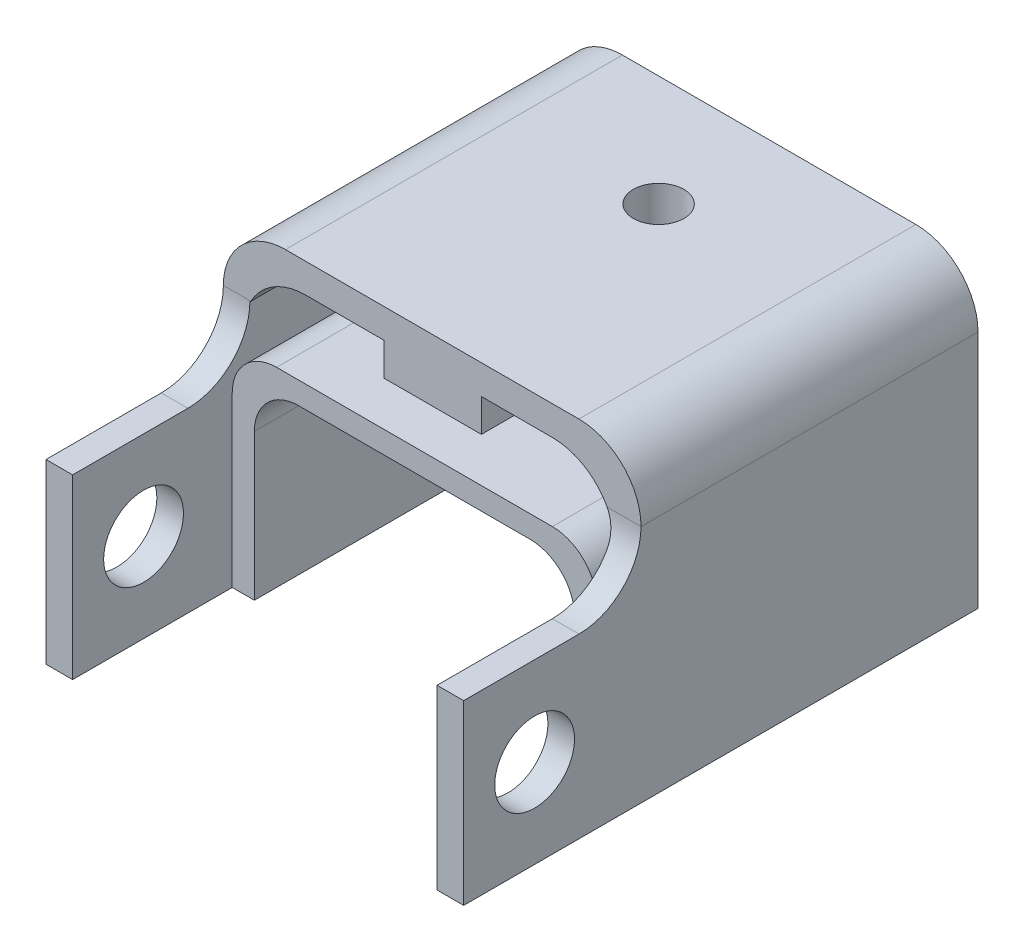
from build123d import *

# Parameters (mm, degrees)
BOSS_EXTRUDE1_DEPTH             = 23.5
BOSS_EXTRUDE1_DEPTH_BACK        = 23.6
SKETCH1_W                       = 38
SKETCH1_H                       = 34
SKETCH2_W                       = 41.1
SKETCH2_H                       = 27
CUT_EXTRUDE1_DEPTH              = 38
FILLET1_R                       = 7
SKETCH3_W                       = 15
SKETCH3_H                       = 3.7
CUT_EXTRUDE2_DEPTH              = 38
FILLET2_R                       = 7
SKETCH4_W                       = 3
SKETCH4_H                       = 20
BOSS_EXTRUDE2_DEPTH             = 20
FILLET3_R                       = 7
CUT_EXTRUDE3_REACH              = 50.651
SKETCH5_R                       = 4.5
CUT_EXTRUDE3_DIRECTION_2_REACH  = 50.651
BOSS_EXTRUDE3_DEPTH             = 40
CUT_EXTRUDE4_DEPTH              = 8
BOSS_EXTRUDE4_DEPTH             = 2.5
BOSS_EXTRUDE5_START             = 2.5
BOSS_EXTRUDE5_DEPTH             = 2.5
BOSS_EXTRUDE6_REACH             = 50.651
SKETCH11_R                      = 8
BOSS_EXTRUDE6_DIRECTION_2_REACH = 50.651
SKETCH12_R                      = 2.85
CUT_EXTRUDE5_DEPTH              = 7


with BuildPart() as part:
    # Sketch1 → Boss-Extrude1 (new, two sides: drawn at the far end of the back side and taken through both)
    with BuildSketch(Plane(origin=(0, 0, 0), x_dir=(0, 0, -1), z_dir=(1, 0, 0)).offset(-BOSS_EXTRUDE1_DEPTH_BACK)):
        Rectangle(SKETCH1_W, SKETCH1_H)
    extrude(amount=BOSS_EXTRUDE1_DEPTH + BOSS_EXTRUDE1_DEPTH_BACK)

    # Sketch2 → Cut-Extrude1 (cut)
    with BuildSketch(Plane.XY.offset(19)):
        with Locations((-0.05, -3.5)):
            Rectangle(SKETCH2_W, SKETCH2_H)
    extrude(amount=-CUT_EXTRUDE1_DEPTH, mode=Mode.SUBTRACT)

    # Fillet1
    fillet1_edges = [part.edges().sort_by_distance(p)[0] for p in [
        (23.5, 17, 0),
        (-23.6, 17, 0),
    ]]
    fillet(fillet1_edges, radius=FILLET1_R)

    # Sketch3 → Cut-Extrude2 (cut)
    with BuildSketch(Plane.XY.offset(19)):
        with Locations((13, 11.85)):
            Rectangle(SKETCH3_W, SKETCH3_H)
        with Locations((-13, 11.85)):
            Rectangle(SKETCH3_W, SKETCH3_H)
    extrude(amount=-CUT_EXTRUDE2_DEPTH, mode=Mode.SUBTRACT)

    # Fillet2
    # the kernel refuses this fillet: 7 mm, written as the material it adds along each edge
    with BuildSketch(Plane(origin=(-20.5, 13.7, 19), x_dir=(1, 0, 0), z_dir=(0, 0, -1))) as fillet2_piece_1:
        with BuildLine():
            CenterArc((6.173329734, 7), FILLET2_R, 208.127068219, 61.872931781)
            Line((0, 3.7), (-0.123466595, 3.634))
            ThreePointArc((-0.123466595, 3.634), (-0.14, 1.85), (-0.14, 0))
            Line((-0.14, 0), (0, -0.14))
            Line((0, -0.14), (6.173329734, -0.14))
            Line((6.173329734, -0.14), (6.173329734, 0))
        make_face()
    extrude(amount=38)
    with BuildSketch(Plane(origin=(20.5, 13.7, 19), x_dir=(0, -1, 0), z_dir=(0, 0, -1))) as fillet2_piece_2:
        with BuildLine():
            CenterArc((FILLET2_R, FILLET2_R), FILLET2_R, 180, 90)
            Line((0, FILLET2_R), (-FILLET2_R * 0.02, FILLET2_R))
            Line((-FILLET2_R * 0.02, FILLET2_R), (-FILLET2_R * 0.02, -FILLET2_R * 0.02))
            Line((-FILLET2_R * 0.02, -FILLET2_R * 0.02), (FILLET2_R, -FILLET2_R * 0.02))
            Line((FILLET2_R, -FILLET2_R * 0.02), (FILLET2_R, 0))
        make_face()
    extrude(amount=38)

    # Sketch4 → Boss-Extrude2 (add)
    with BuildSketch(Plane.XY.offset(19)):
        with Locations((-22.1, -7)):
            Rectangle(SKETCH4_W, SKETCH4_H)
        with Locations((22, -7)):
            Rectangle(SKETCH4_W, SKETCH4_H)
    extrude(amount=BOSS_EXTRUDE2_DEPTH)

    # Fillet3
    fillet3_edges = [part.edges().sort_by_distance(p)[0] for p in [
        (-22.1, 3, 19),
        (22, 3, 19),
    ]]
    fillet(fillet3_edges, radius=FILLET3_R)

    # Cut-Extrude3: up to this face of the body (flat: up to its plane)
    cut_extrude3_end = Plane(part.part.faces().sort_by_distance((-23.6, -4.415554034, 8.225623848))[0])
    # Sketch5 → Cut-Extrude3 (cut, up to the picked face)
    with BuildSketch(Plane(origin=(0, 0, 0), x_dir=(0, 0, -1), z_dir=(1, 0, 0)), mode=Mode.PRIVATE) as cut_extrude3_sk1:
        with Locations((-31, -7)):
            Circle(SKETCH5_R)
    cut_extrude3_tool1 = split(extrude(cut_extrude3_sk1.sketch, amount=-CUT_EXTRUDE3_REACH, mode=Mode.PRIVATE), bisect_by=cut_extrude3_end, keep=Keep.BOTH, mode=Mode.PRIVATE)
    add(cut_extrude3_tool1.solids().sort_by(Axis((0, -7, 31), (-1, 0, 0)))[0], mode=Mode.SUBTRACT)

    # Cut-Extrude3 direction 2: up to this face of the body (flat: up to its plane)
    cut_extrude3_direction_2_end = Plane(part.part.faces().sort_by_distance((23.5, -4.415554034, 8.225623848))[0])
    # Sketch5 → Cut-Extrude3 direction 2 (cut, up to the picked face)
    with BuildSketch(Plane(origin=(0, 0, 0), x_dir=(0, 0, -1), z_dir=(1, 0, 0)), mode=Mode.PRIVATE) as cut_extrude3_direction_2_sk1:
        with Locations((-31, -7)):
            Circle(SKETCH5_R)
    cut_extrude3_direction_2_tool1 = split(extrude(cut_extrude3_direction_2_sk1.sketch, amount=CUT_EXTRUDE3_DIRECTION_2_REACH, mode=Mode.PRIVATE), bisect_by=cut_extrude3_direction_2_end, keep=Keep.BOTH, mode=Mode.PRIVATE)
    add(cut_extrude3_direction_2_tool1.solids().sort_by(Axis((0, -7, 31), (1, 0, 0)))[0], mode=Mode.SUBTRACT)

    # Sketch6 → Boss-Extrude3 (add)
    with BuildSketch(Plane(origin=(0, 0, -19), x_dir=(-1, 0, 0), z_dir=(0, 0, -1))):
        with BuildLine():
            Line((-20.5, -17), (-18, -17))
            Line((-18, -17), (-18, -0.5))
            ThreePointArc((-18, -0.5), (-16.535533906, 3.035533906), (-13, 4.5))
            Line((-13, 4.5), (13.1, 4.5))
            ThreePointArc((13.1, 4.5), (16.635533906, 3.035533906), (18.1, -0.5))
            Line((18.1, -0.5), (18.1, -17))
            Line((18.1, -17), (20.6, -17))
            Line((20.6, -17), (20.6, 2))
            ThreePointArc((20.6, 2), (19.135533906, 5.535533906), (15.6, 7))
            Line((15.6, 7), (-15.5, 7))
            ThreePointArc((-15.5, 7), (-19.035533906, 5.535533906), (-20.5, 2))
            Line((-20.5, 2), (-20.5, -17))
        make_face()
    extrude(amount=-BOSS_EXTRUDE3_DEPTH)

    # Sketch7 → Cut-Extrude4 (cut)
    with BuildSketch(Plane(origin=(0, 0, -19), x_dir=(-1, 0, 0), z_dir=(0, 0, -1))):
        with BuildLine():
            Line((-20.5, 2), (-20.5, -17))
            Line((-20.5, -17), (-18, -17))
            Line((-18, -17), (-18, -0.5))
            ThreePointArc((-18, -0.5), (-16.535533906, 3.035533906), (-13, 4.5))
            Line((-13, 4.5), (13.1, 4.5))
            ThreePointArc((13.1, 4.5), (16.635533906, 3.035533906), (18.1, -0.5))
            Line((18.1, -0.5), (18.1, -17))
            Line((18.1, -17), (20.6, -17))
            Line((20.6, -17), (20.6, 2))
            ThreePointArc((20.6, 2), (19.135533906, 5.535533906), (15.6, 7))
            Line((15.6, 7), (-15.5, 7))
            ThreePointArc((-15.5, 7), (-19.035533906, 5.535533906), (-20.5, 2))
        make_face()
    extrude(amount=-CUT_EXTRUDE4_DEPTH, mode=Mode.SUBTRACT)

    # Sketch8 → Boss-Extrude4 (add)
    with BuildSketch(Plane(origin=(-20.6, 0, 0), x_dir=(0, 0, -1), z_dir=(1, 0, 0))):
        with BuildLine():
            Line((11, -17), (11, -3))
            ThreePointArc((11, -3), (18, -10), (11, -17))
        make_face()
    extrude(amount=BOSS_EXTRUDE4_DEPTH)

    # Sketch9 → Boss-Extrude5 (add)
    with BuildSketch(Plane.ZY.offset(-20.5).offset(BOSS_EXTRUDE5_START)):
        with BuildLine():
            Line((-11, -17), (-11, -3))
            ThreePointArc((-11, -3), (-18, -10), (-11, -17))
        make_face()
    extrude(amount=-BOSS_EXTRUDE5_DEPTH)


with BuildPart() as body_2:

    # Boss-Extrude6: up to this face of the body (flat: up to its plane)
    boss_extrude6_end = Plane(part.part.faces().sort_by_distance((-18.1, -8.909035044, 2.586370643))[0])
    # Sketch11 → Boss-Extrude6 (new, up to the picked face)
    with BuildSketch(Plane(origin=(0, 0, 0), x_dir=(0, 0, -1), z_dir=(1, 0, 0)), mode=Mode.PRIVATE) as boss_extrude6_sk1:
        with Locations((11, -10)):
            Circle(SKETCH11_R)
    boss_extrude6_tool1 = split(extrude(boss_extrude6_sk1.sketch, amount=-BOSS_EXTRUDE6_REACH, mode=Mode.PRIVATE), bisect_by=boss_extrude6_end, keep=Keep.BOTH, mode=Mode.PRIVATE)
    add(boss_extrude6_tool1.solids().sort_by(Axis((0, -10, -11), (-1, 0, 0)))[0])


    # Boss-Extrude6 direction 2: up to this face of the body (flat: up to its plane)
    boss_extrude6_direction_2_end = Plane(part.part.faces().sort_by_distance((18, -8.909035044, 2.586370643))[0])
    # Sketch11 → Boss-Extrude6 direction 2 (add, up to the picked face)
    with BuildSketch(Plane(origin=(0, 0, 0), x_dir=(0, 0, -1), z_dir=(1, 0, 0)), mode=Mode.PRIVATE) as boss_extrude6_direction_2_sk1:
        with Locations((11, -10)):
            Circle(SKETCH11_R)
    boss_extrude6_direction_2_tool1 = split(extrude(boss_extrude6_direction_2_sk1.sketch, amount=BOSS_EXTRUDE6_DIRECTION_2_REACH, mode=Mode.PRIVATE), bisect_by=boss_extrude6_direction_2_end, keep=Keep.BOTH, mode=Mode.PRIVATE)
    add(boss_extrude6_direction_2_tool1.solids().sort_by(Axis((0, -10, -11), (1, 0, 0)))[0])


with BuildPart() as part_1:
    add(part.part)

    # Sketch12 → Cut-Extrude5 (cut)
    with BuildSketch(Plane(origin=(0, 17, 0), x_dir=(1, 0, 0), z_dir=(0, 1, 0))):
        with Locations(Location((-0.017105263, 6.5, 0), (0, 0, 270))):
            Circle(SKETCH12_R)
    extrude(amount=-CUT_EXTRUDE5_DEPTH, mode=Mode.SUBTRACT)


solid = Compound([body_2.part, part_1.part])
